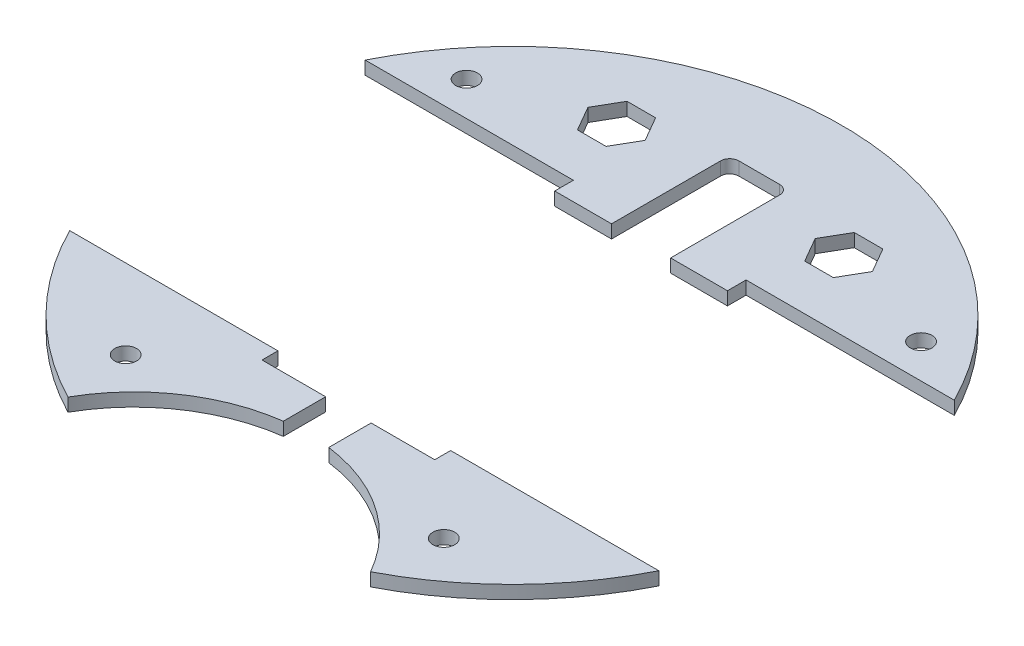
from build123d import *

# Parameters (mm, degrees)
BOSS_EXTRUDE1_DEPTH  = 2.9
SOLENOID_PLACEMENT_W = 38
SOLENOID_PLACEMENT_H = 64.4
CUT_EXTRUDE1_DEPTH   = 103.571487266
CUT_EXTRUDE4_DEPTH   = 103.571487266
CUT_EXTRUDE5_DEPTH   = 103.571487266
SKETCH6_R            = 2.4
CUT_EXTRUDE6_DEPTH   = 103.571487266
CUT_EXTRUDE3_DEPTH   = 103.571487266
SKETCH7_W            = 10
SKETCH7_H            = 62.80248699
CUT_EXTRUDE7_DEPTH   = 98.286484159


with BuildPart() as part:
    # Sketch1 → Boss-Extrude1 (new body)
    with BuildSketch(Plane(origin=(0, 0, 0), x_dir=(1, 0, 0), z_dir=(0, 1, 0))):
        with BuildLine():
            ThreePointArc((33.29110537, -64.404598464), (0, 72.5), (-33.29110537, -64.404598464))
            ThreePointArc((-33.29110537, -64.404598464), (0, -44.989799638), (33.29110537, -64.404598464))
        make_face()
    extrude(amount=BOSS_EXTRUDE1_DEPTH)

    # solenoid placement → Cut-Extrude1 (cut, through all)
    with BuildSketch(Plane(origin=(0, 2.9, 0), x_dir=(1, 0, 0), z_dir=(0, 1, 0))):
        with Locations((0, -3.8)):
            Rectangle(SOLENOID_PLACEMENT_W, SOLENOID_PLACEMENT_H)
    extrude(amount=-CUT_EXTRUDE1_DEPTH, mode=Mode.SUBTRACT)

    # Sketch4 → Cut-Extrude4 (cut, through all)
    with BuildSketch(Plane(origin=(0, 2.9, 0), x_dir=(1, 0, 0), z_dir=(0, 1, 0))):
        with BuildLine():
            Line((-6.5, 28.1), (6.5, 28.1))
            Line((6.5, 28.1), (6.5, 52.4))
            ThreePointArc((6.5, 52.4), (5.914213562, 53.814213562), (4.5, 54.4))
            Line((4.5, 54.4), (-4.5, 54.4))
            ThreePointArc((-4.5, 54.4), (-5.914213562, 53.814213562), (-6.5, 52.4))
            Line((-6.5, 52.4), (-6.5, 28.1))
        make_face()
    extrude(amount=-CUT_EXTRUDE4_DEPTH, mode=Mode.SUBTRACT)

    # Sketch5 → Cut-Extrude5 (cut, through all)
    with BuildSketch(Plane(origin=(0, 2.9, 0), x_dir=(1, 0, 0), z_dir=(0, 1, 0))):
        Polygon((-18.706882066, 48), (-21.853441033, 53.45), (-28.146558967, 53.45), (-31.293117934, 48), (-28.146558967, 42.55), (-21.853441033, 42.55), align=None)
        Polygon((21.853441033, 42.55), (18.706882066, 48), (21.853441033, 53.45), (28.146558967, 53.45), (31.293117934, 48), (28.146558967, 42.55), align=None)
    extrude(amount=-CUT_EXTRUDE5_DEPTH, mode=Mode.SUBTRACT)

    # Sketch6 → Cut-Extrude6 (cut, through all)
    with BuildSketch(Plane(origin=(0, 2.9, 0), x_dir=(1, 0, 0), z_dir=(0, 1, 0))):
        with Locations((35, -50)):
            Circle(SKETCH6_R)
        with Locations((-35, -50)):
            Circle(SKETCH6_R)
        with Locations((-50, 40)):
            Circle(SKETCH6_R)
        with Locations((50, 40)):
            Circle(SKETCH6_R)
    extrude(amount=-CUT_EXTRUDE6_DEPTH, mode=Mode.SUBTRACT)

    # Sketch3 → Cut-Extrude3 (cut, through all)
    with BuildSketch(Plane(origin=(0, 2.9, 0), x_dir=(1, 0, 0), z_dir=(0, 1, 0))):
        Polygon((-19, 28.4), (19, 28.4), (19, 32.5), (72.5, 32.5), (72.5, -32.5), (-72.5, -32.5), (-72.5, 32.5), (-19, 32.5), align=None)
    extrude(amount=-CUT_EXTRUDE3_DEPTH, mode=Mode.SUBTRACT)


with BuildPart() as cut_extrude3_piece_1:
    # of the separate pieces the step leaves, piece 1, a body of its own (cut_extrude3_pieces)
    add(part.part.solids().sort_by_distance((64.807406984, 0, -32.5))[0])


with BuildPart() as cut_extrude3_piece_2:
    # of the separate pieces the step leaves, piece 2, a body of its own (cut_extrude3_pieces)
    add(part.part.solids().sort_by_distance((-33.29110537, 0, 64.404598464))[0])

    # Sketch7 → Cut-Extrude7 (cut, through all)
    with BuildSketch(Plane(origin=(0, 2.9, 0), x_dir=(1, 0, 0), z_dir=(0, 1, 0))):
        with Locations((0, -31.401243495)):
            Rectangle(SKETCH7_W, SKETCH7_H)
    extrude(amount=-CUT_EXTRUDE7_DEPTH, mode=Mode.SUBTRACT)


with BuildPart() as cut_extrude7_piece_1:
    # of the separate pieces the step leaves, piece 1, a body of its own (cut_extrude7_pieces)
    add(cut_extrude3_piece_2.part.solids().sort_by_distance((-33.29110537, 0, 64.404598464))[0])


with BuildPart() as cut_extrude7_piece_2:
    # of the separate pieces the step leaves, piece 2, a body of its own (cut_extrude7_pieces)
    add(cut_extrude3_piece_2.part.solids().sort_by_distance((5, 0, 45.318005113))[0])


solid = Compound([cut_extrude3_piece_1.part, cut_extrude7_piece_1.part, cut_extrude7_piece_2.part])
